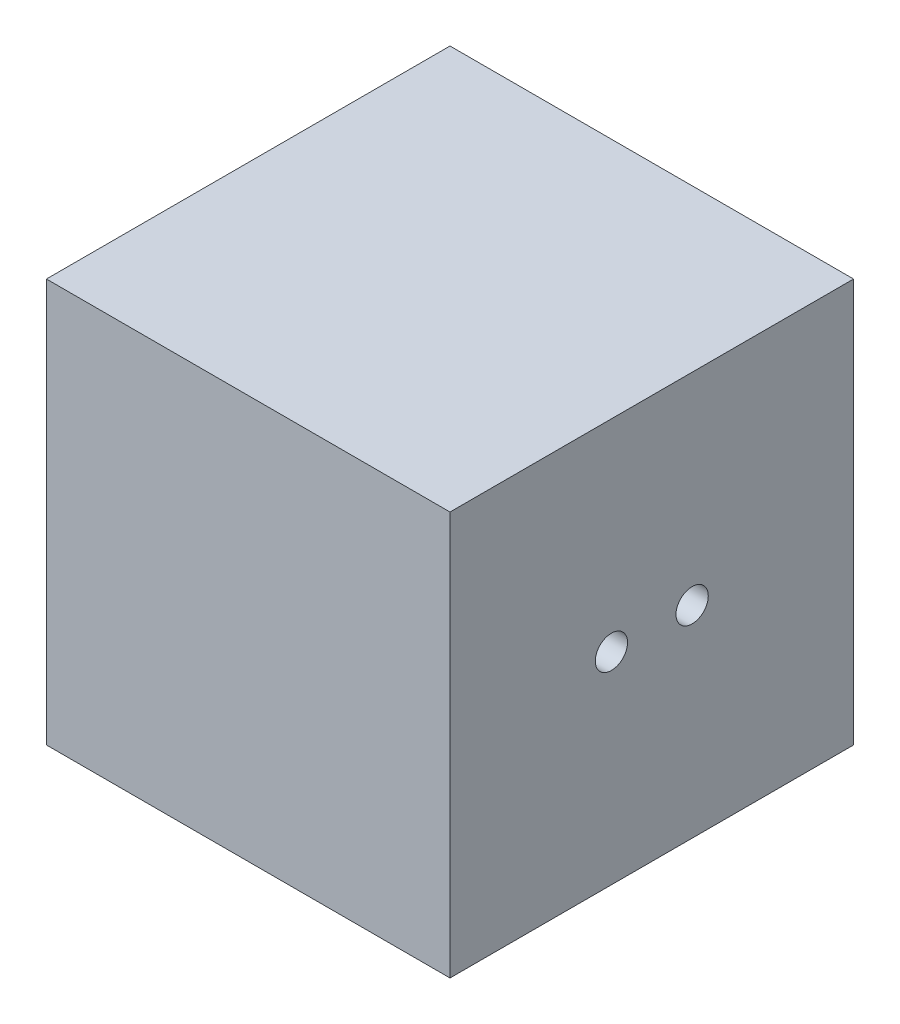
from build123d import *

# Parameters (mm, degrees)
ESBO_O1_W                = 100
ESBO_O1_H                = 100
RESSALTO_EXTRUS_O1_DEPTH = 100
CORTE_EXTRUS_O1_REACH    = 152
ESBO_O2_R                = 4


with BuildPart() as part:
    # Esboço1 → Ressalto-extrusão1 (new body)
    with BuildSketch(Plane.XY):
        Rectangle(ESBO_O1_W, ESBO_O1_H)
    extrude(amount=RESSALTO_EXTRUS_O1_DEPTH)

    # Esboço2 → Corte-extrusão1 (cut, up to next)
    with BuildSketch(Plane(origin=(50, 0, 0), x_dir=(0, 0, -1), z_dir=(1, 0, 0)), mode=Mode.PRIVATE) as corte_extrus_o1_sk1:
        with Locations((-40, 0)):
            Circle(ESBO_O2_R)
    corte_extrus_o1_tool1 = extrude(corte_extrus_o1_sk1.sketch, amount=-CORTE_EXTRUS_O1_REACH, mode=Mode.PRIVATE) & part.part
    # Esboço2 → Corte-extrusão1 (cut, up to next)
    with BuildSketch(Plane(origin=(50, 0, 0), x_dir=(0, 0, -1), z_dir=(1, 0, 0)), mode=Mode.PRIVATE) as corte_extrus_o1_sk2:
        with Locations((-60, 0)):
            Circle(ESBO_O2_R)
    corte_extrus_o1_tool2 = extrude(corte_extrus_o1_sk2.sketch, amount=-CORTE_EXTRUS_O1_REACH, mode=Mode.PRIVATE) & part.part
    add(corte_extrus_o1_tool1.solids().sort_by_distance((50, 0, 40))[0], mode=Mode.SUBTRACT)
    add(corte_extrus_o1_tool2.solids().sort_by_distance((50, 0, 60))[0], mode=Mode.SUBTRACT)


solid = part.part
